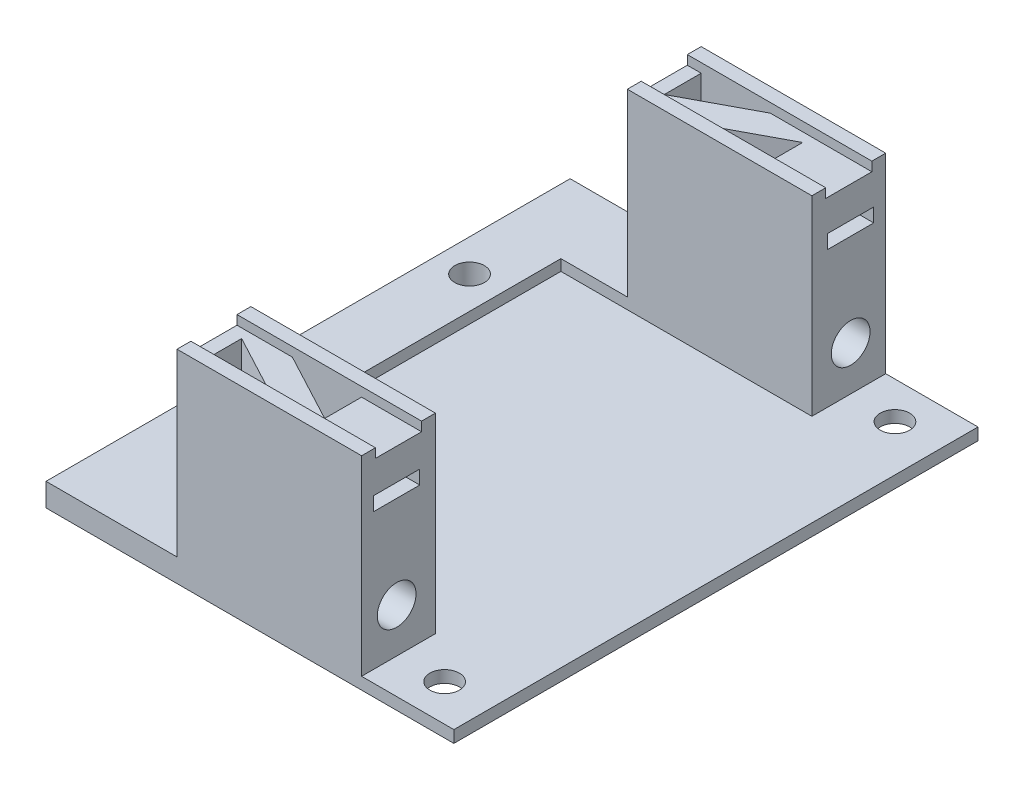
from build123d import *
from build123d.topology import SkipClean

# Parameters (mm, degrees)
BOSS_EXTRU_1_DEPTH      = 2.5
ESQUISSE2_W             = 5
ESQUISSE2_H             = 8
BOSS_EXTRU_2_DEPTH      = 22
ENL_V_MAT_EXTRU_2_REACH = 71.856
ESQUISSE4_R             = 1.6
EXTRU_MINCE1_OUTLINE_W  = 15
EXTRU_MINCE1_OUTLINE_H  = 8
EXTRU_MINCE1_DEPTH      = 19.5
BOSS_EXTRU_3_DEPTH      = 1.3
ESQUISSE3_R             = 2.1
ESQUISSE3_W             = 5
ESQUISSE3_H             = 1.5
ENL_V_MAT_EXTRU_1_DEPTH = 70.856137884
ENL_V_MAT_EXTRU_3_REACH = 76.889
ESQUISSE7_R             = 1.6
ESQUISSE8_W             = 20
ESQUISSE8_H             = 5
ENL_V_MAT_EXTRU_5_DEPTH = 1


# Read off the part's stored shape, not the designer's step: Extru.-Mince1
with BuildPart() as part:
    # Esquisse1 → Boss.-Extru.1 (new body)
    with BuildSketch(Plane(origin=(0, 0, 0), x_dir=(1, 0, 0), z_dir=(0, 1, 0))):
        Polygon((0, 0), (29.2, 0), (29.2, 8), (7, 8), (7, 48.8), (29.2, 48.8), (29.2, 56.8), (0, 56.8), align=None)
    extrude(amount=BOSS_EXTRU_1_DEPTH)

    # Esquisse2 → Boss.-Extru.2 (add)
    with BuildSketch(Plane(origin=(0, 0, 0), x_dir=(1, 0, 0), z_dir=(0, 1, 0))):
        with Locations((31.7, 52.8)):
            Rectangle(ESQUISSE2_W, ESQUISSE2_H)
        with Locations((31.7, 4)):
            Rectangle(ESQUISSE2_W, ESQUISSE2_H)
    extrude(amount=BOSS_EXTRU_2_DEPTH)

    # Esquisse4 → Enlèv. mat.-Extru.2 (cut, up to next)
    with BuildSketch(Plane(origin=(0, 0, 0), x_dir=(1, 0, 0), z_dir=(0, 1, 0)), mode=Mode.PRIVATE) as enl_v_mat_extru_2_sk1:
        with Locations(Location((3.5, 14.4, 0), (0, 0, 270))):
            Circle(ESQUISSE4_R)
    enl_v_mat_extru_2_tool1 = extrude(enl_v_mat_extru_2_sk1.sketch, amount=ENL_V_MAT_EXTRU_2_REACH, mode=Mode.PRIVATE) & part.part
    # Esquisse4 → Enlèv. mat.-Extru.2 (cut, up to next)
    with BuildSketch(Plane(origin=(0, 0, 0), x_dir=(1, 0, 0), z_dir=(0, 1, 0)), mode=Mode.PRIVATE) as enl_v_mat_extru_2_sk2:
        with Locations(Location((3.5, 42.4, 0), (0, 0, 90))):
            Circle(ESQUISSE4_R)
    enl_v_mat_extru_2_tool2 = extrude(enl_v_mat_extru_2_sk2.sketch, amount=ENL_V_MAT_EXTRU_2_REACH, mode=Mode.PRIVATE) & part.part
    add(enl_v_mat_extru_2_tool1.solids().sort_by_distance((3.5, 0, -14.4))[0], mode=Mode.SUBTRACT)
    add(enl_v_mat_extru_2_tool2.solids().sort_by_distance((3.5, 0, -42.4))[0], mode=Mode.SUBTRACT)

    # Extru.-Mince1 outline → Extru.-Mince1 (add)
    with BuildSketch(Plane(origin=(0, 2.5, 0), x_dir=(1, 0, 0), z_dir=(0, 1, 0))):
        with Locations((21.7, 52.8)):
            Rectangle(EXTRU_MINCE1_OUTLINE_W, EXTRU_MINCE1_OUTLINE_H)
        Polygon((27.7, 50.3), (20.2, 50.3), (27.7, 54.3), align=None, mode=Mode.SUBTRACT)
        Polygon((15.7, 51.3), (15.7, 55.3), (23.2, 55.3), align=None, mode=Mode.SUBTRACT)
    extru_mince1 = extrude(amount=EXTRU_MINCE1_DEPTH)

    # Esquisse6 → Boss.-Extru.3 (add)
    with BuildSketch(Plane.XZ):
        Polygon((34.2, -8), (7, -8), (7, -48.8), (34.2, -48.8), (34.2, -56.8), (44.2, -56.8), (44.2, 0), (34.2, 0), align=None)
    extrude(amount=-BOSS_EXTRU_3_DEPTH)

    # Esquisse3 → Enlèv. mat.-Extru.1 (cut, through all)
    with BuildSketch(Plane(origin=(34.2, 0, 0), x_dir=(0, 0, -1), z_dir=(1, 0, 0))):
        with Locations((3.8, 6.1)):
            Circle(ESQUISSE3_R)
        with Locations((53, 6.1)):
            Circle(ESQUISSE3_R)
        with Locations((3.8, 16.85)):
            Rectangle(ESQUISSE3_W, ESQUISSE3_H)
        with Locations((53, 16.85)):
            Rectangle(ESQUISSE3_W, ESQUISSE3_H)
    enl_v_mat_extru_1 = extrude(amount=-ENL_V_MAT_EXTRU_1_DEPTH, mode=Mode.SUBTRACT)

    # Symétrie1: Extru.-Mince1, Enlèv. mat.-Extru.1 across plane
    with SkipClean():  # the faces are left unmerged after this step: merging them gives an invalid solid
        add(extru_mince1.mirror(Plane(origin=(0, 0, -28.4), x_dir=(1, 0, 0), z_dir=(0, 0, -1))))
        add(enl_v_mat_extru_1.mirror(Plane(origin=(0, 0, -28.4), x_dir=(1, 0, 0), z_dir=(0, 0, -1))), mode=Mode.SUBTRACT)

    # Esquisse7 → Enlèv. mat.-Extru.3 (cut, up to next)
    with BuildSketch(Plane(origin=(0, 1.3, 0), x_dir=(1, 0, 0), z_dir=(0, 1, 0)), mode=Mode.PRIVATE) as enl_v_mat_extru_3_sk1:
        with Locations(Location((39.2, 52.8, 0), (0, 0, 270))):
            Circle(ESQUISSE7_R)
    enl_v_mat_extru_3_tool1 = extrude(enl_v_mat_extru_3_sk1.sketch, amount=-ENL_V_MAT_EXTRU_3_REACH, mode=Mode.PRIVATE) & part.part
    # Esquisse7 → Enlèv. mat.-Extru.3 (cut, up to next)
    with BuildSketch(Plane(origin=(0, 1.3, 0), x_dir=(1, 0, 0), z_dir=(0, 1, 0)), mode=Mode.PRIVATE) as enl_v_mat_extru_3_sk2:
        with Locations(Location((39.2, 4, 0), (0, 0, 270))):
            Circle(ESQUISSE7_R)
    enl_v_mat_extru_3_tool2 = extrude(enl_v_mat_extru_3_sk2.sketch, amount=-ENL_V_MAT_EXTRU_3_REACH, mode=Mode.PRIVATE) & part.part
    add(enl_v_mat_extru_3_tool1.solids().sort_by_distance((39.2, 1.3, -52.8))[0], mode=Mode.SUBTRACT)
    add(enl_v_mat_extru_3_tool2.solids().sort_by_distance((39.2, 1.3, -4))[0], mode=Mode.SUBTRACT)

    # Esquisse8 → Enlèv. mat.-Extru.5 (cut)
    with SkipClean():  # the faces are left unmerged after this step: merging them gives an invalid solid
        with BuildSketch(Plane(origin=(0, 22, 0), x_dir=(1, 0, 0), z_dir=(0, 1, 0))):
            with Locations((24.2, 52.8)):
                Rectangle(ESQUISSE8_W, ESQUISSE8_H)
            with Locations((24.2, 4)):
                Rectangle(ESQUISSE8_W, ESQUISSE8_H)
        extrude(amount=-ENL_V_MAT_EXTRU_5_DEPTH, mode=Mode.SUBTRACT)


solid = part.part
